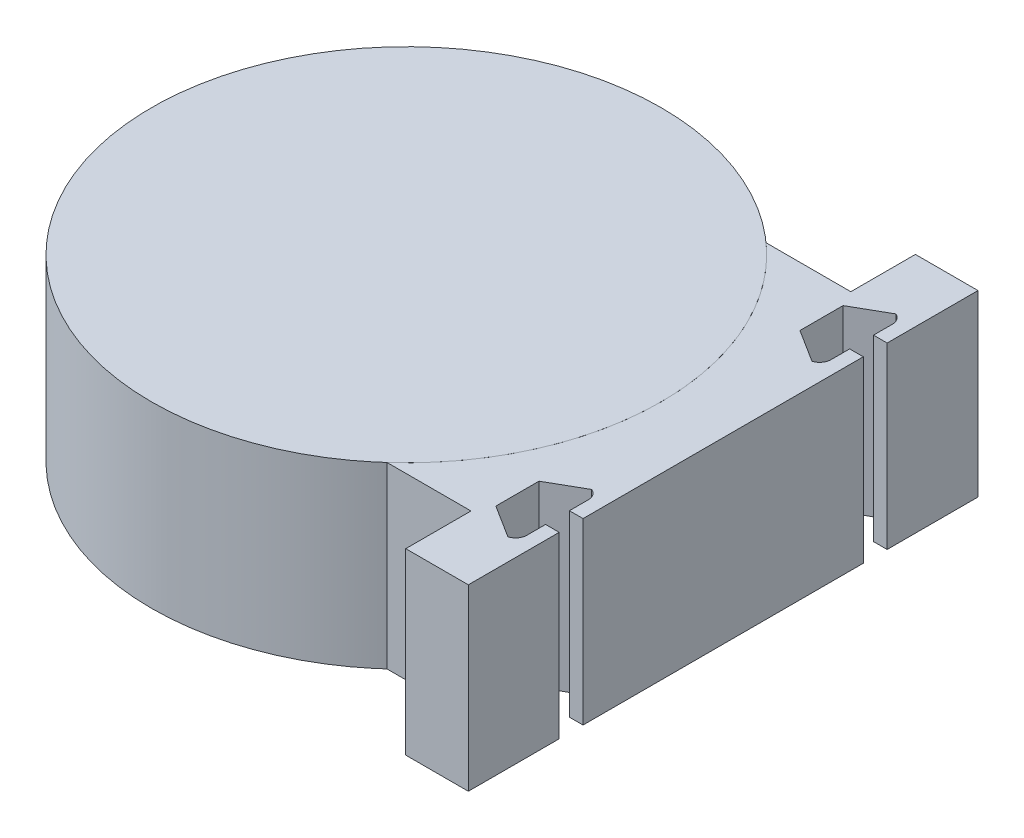
from build123d import *

# Parameters (mm, degrees)
SKETCH1_R               = 28.5
BOSS_EXTRUDE1_DEPTH     = 20
BOSS_EXTRUDE3_DEPTH     = 20
CUT_EXTRUDE1_DEPTH      = 50.676564409
CUT_EXTRUDE1_DEPTH_BACK = 50.676564409
CUT_EXTRUDE2_DEPTH      = 50.676564409
CUT_EXTRUDE2_DEPTH_BACK = 50.676564409
FILLET1_R               = 1.27


with BuildPart() as part:
    # Sketch1 → Boss-Extrude1 (new body)
    with BuildSketch(Plane(origin=(0, 0, 0), x_dir=(1, 0, 0), z_dir=(0, 1, 0))):
        with Locations(Location((0, 0, 0), (0, 0, 270))):
            Circle(SKETCH1_R)
    extrude(amount=BOSS_EXTRUDE1_DEPTH)


with BuildPart() as body_2:
    # Sketch2 → Boss-Extrude3 (new body)
    with BuildSketch(Plane(origin=(0, 20, 0), x_dir=(1, 0, 0), z_dir=(0, 1, 0))):
        with BuildLine():
            Line((35.433191382, 28.5), (28.433191382, 28.5))
            Line((28.433191382, 28.5), (28.433191382, 21.277058423))
            Line((28.433191382, 21.277058423), (18.961455241, 21.277058423))
            ThreePointArc((18.961455241, 21.277058423), (28.499942219, 0.057389264), (19.046990751, -21.200522242))
            Line((19.046990751, -21.200522242), (28.433191382, -21.200522242))
            Line((28.433191382, -21.200522242), (28.433191382, -28.5))
            Line((28.433191382, -28.5), (35.433191382, -28.5))
            Line((35.433191382, -28.5), (35.433191382, 28.5))
        make_face()
    extrude(amount=-BOSS_EXTRUDE3_DEPTH)

    # Sketch6 → Cut-Extrude1 (cut, two sides: drawn at the far end of the back side and taken through both)
    with BuildSketch(Plane.XZ.offset(-CUT_EXTRUDE1_DEPTH_BACK)):
        Polygon((35.433191382, 18.338), (33.909191382, 18.338), (33.909191382, 21.64), (32.998977436, 21.64), (29.346059083, 19.337542289), (29.346059083, 14.511542289), (33.095010475, 12.369), (33.909191382, 12.369), (33.909191382, 15.671), (35.433191382, 15.671), align=None)
    extrude(amount=CUT_EXTRUDE1_DEPTH + CUT_EXTRUDE1_DEPTH_BACK, mode=Mode.SUBTRACT)

    # Sketch8 → Cut-Extrude2 (cut, two sides: drawn at the far end of the back side and taken through both)
    with BuildSketch(Plane.XZ.offset(-CUT_EXTRUDE2_DEPTH_BACK)):
        Polygon((35.433191382, -15.671), (33.909191382, -15.671), (33.909191382, -12.369), (32.998977436, -12.369), (29.346059083, -14.671457711), (29.346059083, -19.497457711), (33.095010475, -21.64), (33.909191382, -21.64), (33.909191382, -18.338), (35.433191382, -18.338), align=None)
    extrude(amount=CUT_EXTRUDE2_DEPTH + CUT_EXTRUDE2_DEPTH_BACK, mode=Mode.SUBTRACT)

    # Fillet1
    # the kernel refuses this fillet: 1.27 mm, written as the material it adds along each edge
    with BuildSketch(Plane(origin=(33.909191382, 20, -21.64), x_dir=(0, 0, 1), z_dir=(0, -1, 0)), Plane(origin=(33.909191382, 20, 12.369), x_dir=(0, 0, 1), z_dir=(0, -1, 0))) as fillet1_piece_1:
        with BuildLine():
            CenterArc((1.185381354, 1.27), FILLET1_R, 201.033434492, 68.966565508)
            Line((0, 0.814180907), (-0.023707627, 0.805064525))
            ThreePointArc((-0.023707627, 0.805064525), (-0.0254, 0.407090453), (-0.0254, 0))
            Line((-0.0254, 0), (0, -0.0254))
            Line((0, -0.0254), (1.185381354, -0.0254))
            Line((1.185381354, -0.0254), (1.185381354, 0))
        make_face()
    extrude(amount=20)
    with BuildSketch(Plane(origin=(33.909191382, 20, -12.369), x_dir=(-1, 0, 0), z_dir=(0, -1, 0)), Plane(origin=(33.909191382, 20, 21.64), x_dir=(-1, 0, 0), z_dir=(0, -1, 0))) as fillet1_piece_2:
        with BuildLine():
            CenterArc((1.27, 1.217971262), FILLET1_R, 180, 73.542974509)
            Line((0, 1.217971262), (-0.0254, 1.217971262))
            Line((-0.0254, 1.217971262), (-0.0254, 0))
            Line((-0.0254, 0), (0, -0.0254))
            ThreePointArc((0, -0.0254), (0.455106973, -0.0254), (0.903018225, -0.024359425))
            Line((0.903018225, -0.024359425), (0.910213946, 0))
        make_face()
    extrude(amount=20)


solid = Compound([part.part, body_2.part])
